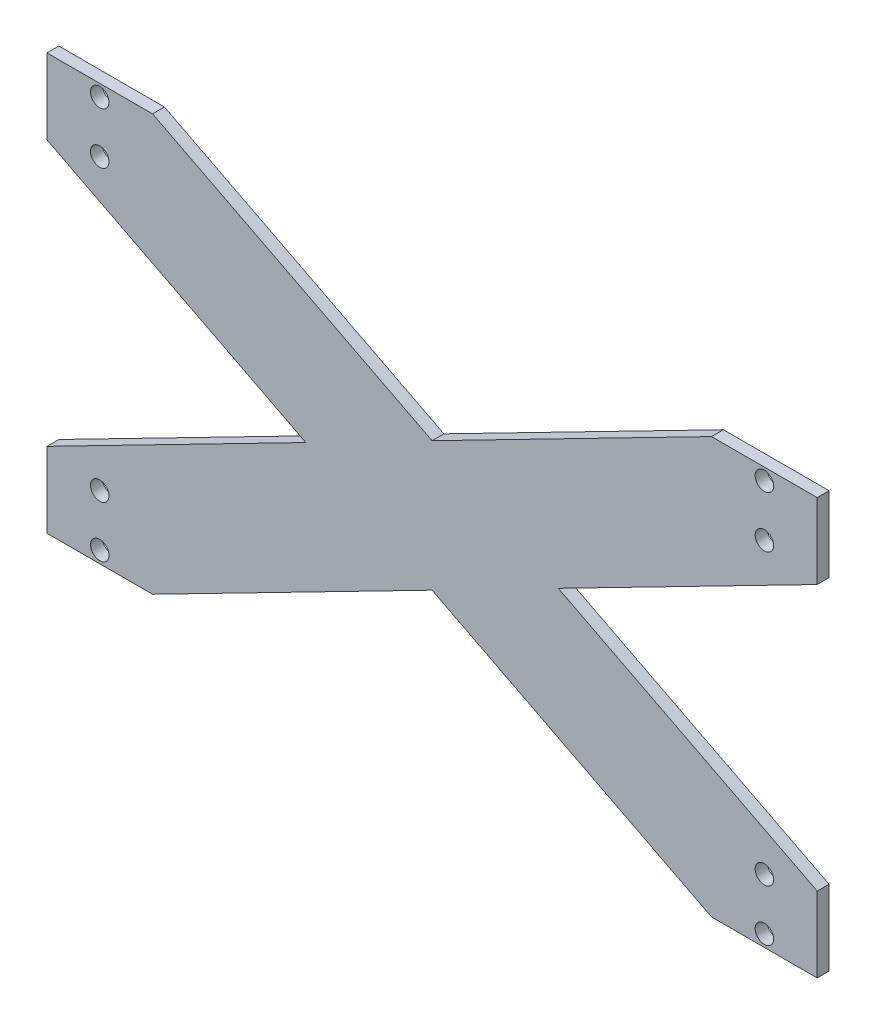
from build123d import *

# Parameters (mm, degrees)
SKETCH1_R           = 3.5
BOSS_EXTRUDE1_DEPTH = 4.5


with BuildPart() as part:
    # Sketch1 → Boss-Extrude1 (new body)
    with BuildSketch(Plane.XY):
        Polygon((6.342010442, 16.5), (6.342010442, -12), (104.348987187, -62.25), (6.342010442, -112.5), (6.342010442, -141), (46.342010442, -141), (152.142010442, -86.754372019), (257.942010442, -141), (297.942010442, -141), (297.942010442, -112.5), (199.935033698, -62.25), (297.942010442, -12), (297.942010442, 16.5), (257.942010442, 16.5), (152.142010442, -37.745627981), (46.342010442, 16.5), align=None)
        with Locations((26.342010442, -7.5)):
            Circle(SKETCH1_R, mode=Mode.SUBTRACT)
        with Locations((26.342010442, 12)):
            Circle(SKETCH1_R, mode=Mode.SUBTRACT)
        with Locations((26.342010442, -117)):
            Circle(SKETCH1_R, mode=Mode.SUBTRACT)
        with Locations((26.342010442, -136.5)):
            Circle(SKETCH1_R, mode=Mode.SUBTRACT)
        with Locations((277.942010442, 12)):
            Circle(SKETCH1_R, mode=Mode.SUBTRACT)
        with Locations((277.942010442, -7.5)):
            Circle(SKETCH1_R, mode=Mode.SUBTRACT)
        with Locations((277.942010442, -117)):
            Circle(SKETCH1_R, mode=Mode.SUBTRACT)
        with Locations((277.942010442, -136.5)):
            Circle(SKETCH1_R, mode=Mode.SUBTRACT)
    extrude(amount=BOSS_EXTRUDE1_DEPTH)


solid = part.part
